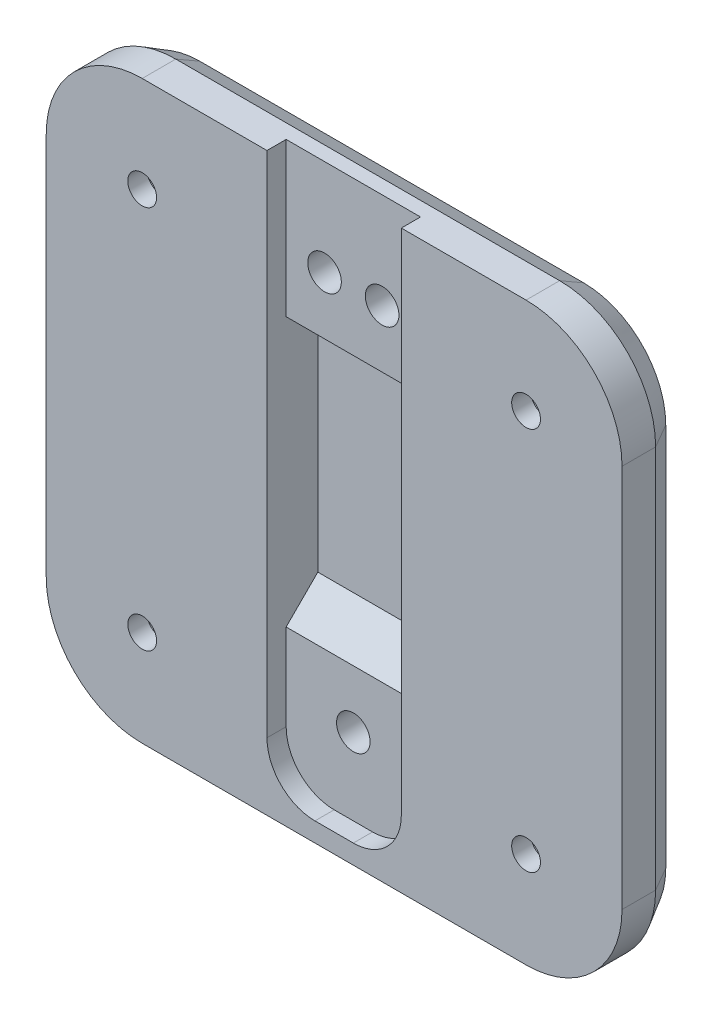
from build123d import *
from OCP.BRepFilletAPI import BRepFilletAPI_MakeChamfer

# Parameters (mm, degrees)
BOSS_EXTRUDE1_DEPTH     = 6
CHAMFER1_SIZE           = 2.5
CHAMFER1_SIZE2          = 1.443375673
CUT_EXTRUDE1_DEPTH      = 43.848570571
CUT_EXTRUDE1_DEPTH_BACK = 28
SKETCH2_W               = 14
SKETCH2_H               = 6.892407629
SKETCH3_W               = 14
SKETCH3_H               = 20
CUT_EXTRUDE2_DEPTH      = 3.3
CHAMFER2_SIZE           = 4
HOLE1_D                 = 3
HOLE1_CBORE_D           = 4.1
HOLE1_CBORE_DEPTH       = 4
HOLE2_D                 = 3
HOLE2_CBORE_D           = 3.5
HOLE2_CBORE_DEPTH       = 20
FILLET2_R               = 5
CHAMFER3_SIZE           = 2
CHAMFER3_SIZE2          = 0.535898385


with BuildPart() as part:
    # Sketch1 → Boss-Extrude1 (new body)
    with BuildSketch(Plane.XY):
        with BuildLine():
            Line((-20, 30), (20, 30))
            ThreePointArc((20, 30), (27.071067812, 27.071067812), (30, 20))
            Line((30, 20), (30, -20))
            ThreePointArc((30, -20), (27.071067812, -27.071067812), (20, -30))
            Line((20, -30), (-20, -30))
            ThreePointArc((-20, -30), (-27.071067812, -27.071067812), (-30, -20))
            Line((-30, -20), (-30, 20))
            ThreePointArc((-30, 20), (-27.071067812, 27.071067812), (-20, 30))
        make_face()
    extrude(amount=BOSS_EXTRUDE1_DEPTH)

    # Chamfer1: one chamfer whose edges measure the first distance from different faces: ONE call of the kernel's chamfer builder (chamfer() names one face for all edges)
    chamfer1_edges_1 = [part.edges().sort_by_distance(p)[0] for p in [
        (0, 30, 0),
    ]]
    chamfer1_side_1 = [part.faces().sort_by_distance(p)[0] for p in [
        (0, 30, 3),
    ]]
    chamfer1_edges_2 = [part.edges().sort_by_distance(p)[0] for p in [
        (27.071067812, 27.071067812, 0),
    ]]
    chamfer1_side_2 = [part.faces().sort_by_distance(p)[0] for p in [
        (27.071067812, 27.071067812, 3),
    ]]
    chamfer1_edges_3 = [part.edges().sort_by_distance(p)[0] for p in [
        (30, 0, 0),
    ]]
    chamfer1_side_3 = [part.faces().sort_by_distance(p)[0] for p in [
        (30, 0, 3),
    ]]
    chamfer1_edges_4 = [part.edges().sort_by_distance(p)[0] for p in [
        (27.071067812, -27.071067812, 0),
    ]]
    chamfer1_side_4 = [part.faces().sort_by_distance(p)[0] for p in [
        (27.071067812, -27.071067812, 3),
    ]]
    chamfer1_edges_5 = [part.edges().sort_by_distance(p)[0] for p in [
        (0, -30, 0),
    ]]
    chamfer1_side_5 = [part.faces().sort_by_distance(p)[0] for p in [
        (0, -30, 3),
    ]]
    chamfer1_edges_6 = [part.edges().sort_by_distance(p)[0] for p in [
        (-27.071067812, -27.071067812, 0),
    ]]
    chamfer1_side_6 = [part.faces().sort_by_distance(p)[0] for p in [
        (-27.071067812, -27.071067812, 3),
    ]]
    chamfer1_edges_7 = [part.edges().sort_by_distance(p)[0] for p in [
        (-30, 0, 0),
    ]]
    chamfer1_side_7 = [part.faces().sort_by_distance(p)[0] for p in [
        (-30, 0, 3),
    ]]
    chamfer1_edges_8 = [part.edges().sort_by_distance(p)[0] for p in [
        (-27.071067812, 27.071067812, 0),
    ]]
    chamfer1_side_8 = [part.faces().sort_by_distance(p)[0] for p in [
        (-27.071067812, 27.071067812, 3),
    ]]
    chamfer1 = BRepFilletAPI_MakeChamfer(part.part.solid().wrapped)
    for e in chamfer1_edges_1:
        chamfer1.Add(CHAMFER1_SIZE, CHAMFER1_SIZE2, e.wrapped, chamfer1_side_1[0].wrapped)  # the first distance lies on this face
    for e in chamfer1_edges_2:
        chamfer1.Add(CHAMFER1_SIZE, CHAMFER1_SIZE2, e.wrapped, chamfer1_side_2[0].wrapped)  # the first distance lies on this face
    for e in chamfer1_edges_3:
        chamfer1.Add(CHAMFER1_SIZE, CHAMFER1_SIZE2, e.wrapped, chamfer1_side_3[0].wrapped)  # the first distance lies on this face
    for e in chamfer1_edges_4:
        chamfer1.Add(CHAMFER1_SIZE, CHAMFER1_SIZE2, e.wrapped, chamfer1_side_4[0].wrapped)  # the first distance lies on this face
    for e in chamfer1_edges_5:
        chamfer1.Add(CHAMFER1_SIZE, CHAMFER1_SIZE2, e.wrapped, chamfer1_side_5[0].wrapped)  # the first distance lies on this face
    for e in chamfer1_edges_6:
        chamfer1.Add(CHAMFER1_SIZE, CHAMFER1_SIZE2, e.wrapped, chamfer1_side_6[0].wrapped)  # the first distance lies on this face
    for e in chamfer1_edges_7:
        chamfer1.Add(CHAMFER1_SIZE, CHAMFER1_SIZE2, e.wrapped, chamfer1_side_7[0].wrapped)  # the first distance lies on this face
    for e in chamfer1_edges_8:
        chamfer1.Add(CHAMFER1_SIZE, CHAMFER1_SIZE2, e.wrapped, chamfer1_side_8[0].wrapped)  # the first distance lies on this face
    add(Compound.cast(chamfer1.Shape()), mode=Mode.REPLACE)

    # Sketch2 → Cut-Extrude1 (cut, two sides: drawn at the far end of the back side and taken through both)
    with BuildSketch(Plane(origin=(0, 0, 0), x_dir=(1, 0, 0), z_dir=(0, 1, 0)).offset(-CUT_EXTRUDE1_DEPTH_BACK)):
        with Locations((0, -7.446203815)):
            Rectangle(SKETCH2_W, SKETCH2_H)
    extrude(amount=CUT_EXTRUDE1_DEPTH + CUT_EXTRUDE1_DEPTH_BACK, mode=Mode.SUBTRACT)

    # Sketch3 → Cut-Extrude2 (cut)
    with BuildSketch(Plane.XY.offset(4)):
        Rectangle(SKETCH3_W, SKETCH3_H)
    extrude(amount=-CUT_EXTRUDE2_DEPTH, mode=Mode.SUBTRACT)

    # Chamfer2
    # the kernel refuses this chamfer: 4 mm, written as the material it takes off along each edge
    with BuildSketch(Plane(origin=(-7, 10, 4), x_dir=(0, 0.9996219169112968, 0.02749587661058627), z_dir=(1, 0, 0))) as chamfer2_piece_1_section:
        Polygon((CHAMFER2_SIZE * 0.999621916911, -CHAMFER2_SIZE * 0.0274958766106), (-CHAMFER2_SIZE * 0.0274958766106, -CHAMFER2_SIZE * 0.999621916911), (0, 0), align=None)
    chamfer2_piece_1 = extrude(amount=14, mode=Mode.PRIVATE)
    chamfer2_piece_1 = split(chamfer2_piece_1, bisect_by=Plane(origin=(0, 11.371649583, 0.7), z_dir=(0, 0, 1)), keep=Keep.TOP, mode=Mode.PRIVATE)
    add(chamfer2_piece_1, mode=Mode.SUBTRACT)
    with BuildSketch(Plane(origin=(7, -10, 4), x_dir=(0, -0.9996219169112968, 0.02749587661058627), z_dir=(-1, 0, 0))) as chamfer2_piece_2_section:
        Polygon((CHAMFER2_SIZE * 0.999621916911, -CHAMFER2_SIZE * 0.0274958766106), (-CHAMFER2_SIZE * 0.0274958766106, -CHAMFER2_SIZE * 0.999621916911), (0, 0), align=None)
    chamfer2_piece_2 = extrude(amount=14, mode=Mode.PRIVATE)
    chamfer2_piece_2 = split(chamfer2_piece_2, bisect_by=Plane(origin=(0, -11.371649583, 0.7), z_dir=(0, 0, 1)), keep=Keep.TOP, mode=Mode.PRIVATE)
    add(chamfer2_piece_2, mode=Mode.SUBTRACT)

    # Hole1 (through all)
    with Locations(Plane(origin=(0, 0, 0), x_dir=(-1, 0, 0), z_dir=(0, 0, -1))):
        with Locations((20, -20), (-20, -20), (-20, 20), (20, 20)):
            CounterBoreHole(HOLE1_D / 2, HOLE1_CBORE_D / 2, HOLE1_CBORE_DEPTH)

    # Hole2 (through all)
    with Locations(Plane.XY.offset(4)):
        with Locations((3, 20), (-3, 20), (0, -20)):
            CounterBoreHole(HOLE2_D / 2, HOLE2_CBORE_D / 2, HOLE2_CBORE_DEPTH)

    # Fillet2
    fillet2_edges = [part.edges().sort_by_distance(p)[0] for p in [
        (-7, -28, 5),
        (7, -28, 5),
    ]]
    fillet(fillet2_edges, radius=FILLET2_R)

    # Chamfer3: one chamfer whose edges measure the first distance from different faces: ONE call of the kernel's chamfer builder (chamfer() names one face for all edges)
    chamfer3_edges_1 = [part.edges().sort_by_distance(p)[0] for p in [
        (22.05, 20, 0),
    ]]
    chamfer3_side_1 = [part.faces().sort_by_distance(p)[0] for p in [
        (22.05, 20, 2),
    ]]
    chamfer3_edges_2 = [part.edges().sort_by_distance(p)[0] for p in [
        (22.05, -20, 0),
    ]]
    chamfer3_side_2 = [part.faces().sort_by_distance(p)[0] for p in [
        (22.05, -20, 2),
    ]]
    chamfer3_edges_3 = [part.edges().sort_by_distance(p)[0] for p in [
        (-17.95, -20, 0),
    ]]
    chamfer3_side_3 = [part.faces().sort_by_distance(p)[0] for p in [
        (-17.95, -20, 2),
    ]]
    chamfer3_edges_4 = [part.edges().sort_by_distance(p)[0] for p in [
        (-17.95, 20, 0),
    ]]
    chamfer3_side_4 = [part.faces().sort_by_distance(p)[0] for p in [
        (-17.95, 20, 2),
    ]]
    chamfer3 = BRepFilletAPI_MakeChamfer(part.part.solid().wrapped)
    for e in chamfer3_edges_1:
        chamfer3.Add(CHAMFER3_SIZE, CHAMFER3_SIZE2, e.wrapped, chamfer3_side_1[0].wrapped)  # the first distance lies on this face
    for e in chamfer3_edges_2:
        chamfer3.Add(CHAMFER3_SIZE, CHAMFER3_SIZE2, e.wrapped, chamfer3_side_2[0].wrapped)  # the first distance lies on this face
    for e in chamfer3_edges_3:
        chamfer3.Add(CHAMFER3_SIZE, CHAMFER3_SIZE2, e.wrapped, chamfer3_side_3[0].wrapped)  # the first distance lies on this face
    for e in chamfer3_edges_4:
        chamfer3.Add(CHAMFER3_SIZE, CHAMFER3_SIZE2, e.wrapped, chamfer3_side_4[0].wrapped)  # the first distance lies on this face
    add(Compound.cast(chamfer3.Shape()), mode=Mode.REPLACE)


solid = part.part
